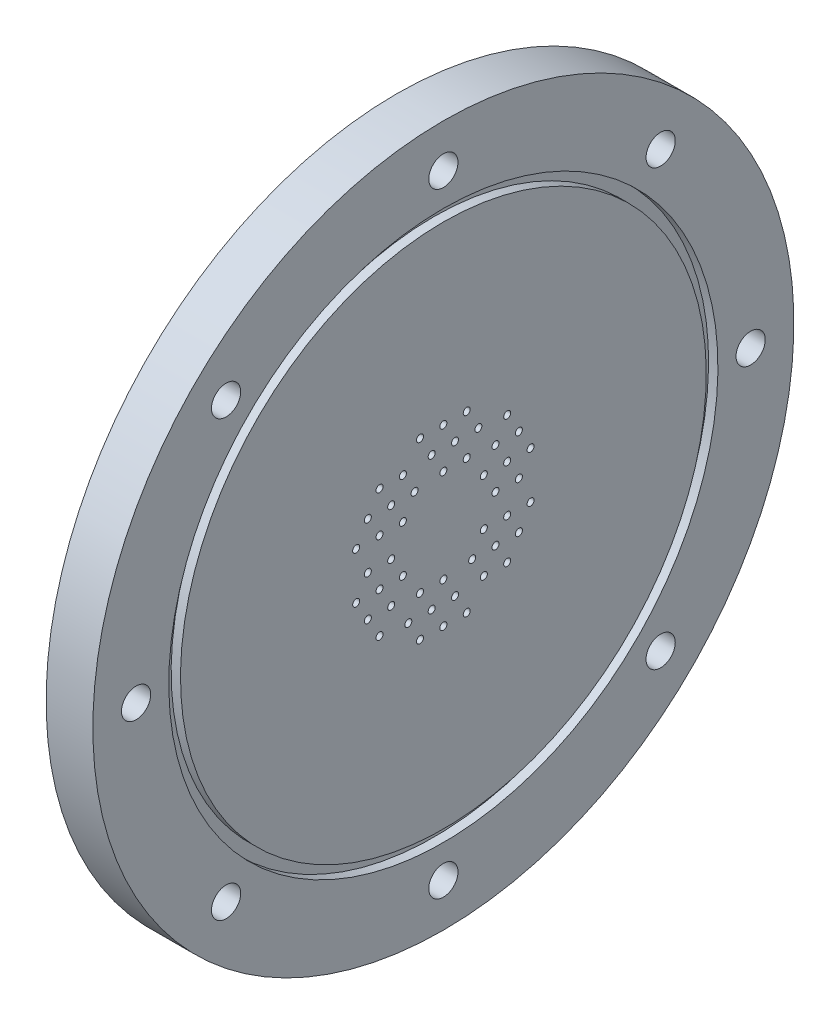
from build123d import *

# Parameters (mm, degrees)
SKETCH2_R                    = 0.762
CUT_EXTRUDE1_DEPTH           = 109.240960824
CHAMFER1_SIZE                = 0.508
CIRPATTERN1_COUNT            = 6
CHAMFER1_OF_CIRPATTERN1_SIZE = 0.508
SKETCH3_R                    = 3.175
CUT_EXTRUDE2_DEPTH           = 109.240960824
CIRPATTERN2_COUNT            = 8
SKETCH4_W                    = 2.032
SKETCH4_H                    = 2.54
SKETCH4_W_2                  = 1.27


with BuildPart() as part:
    # Sketch1 → Revolve1 (revolve)
    with BuildSketch(Plane.XY):
        with BuildLine():
            Line((0, 0), (0, 48.26))
            ThreePointArc((0, 48.26), (-0.743948776, 50.056051224), (-2.54, 50.8))
            Line((-2.54, 50.8), (-6.35, 50.8))
            Line((-6.35, 50.8), (-6.35, 76.2))
            Line((-6.35, 76.2), (3.81, 76.2))
            Line((3.81, 76.2), (3.81, 0))
            Line((3.81, 0), (0, 0))
        make_face()
    revolve(axis=Axis((-6.35, 0, 0), (1, 0, 0)))

    # Sketch2 → Cut-Extrude1 (cut, through all)
    with BuildSketch(Plane(origin=(3.81, 0, 0), x_dir=(0, 0, -1), z_dir=(1, 0, 0))):
        with Locations((0, 10.16)):
            Circle(SKETCH2_R)
        with Locations((-2.54, 14.559409051)):
            Circle(SKETCH2_R)
        with Locations((5.08, 10.16)):
            Circle(SKETCH2_R)
        with Locations((-5.08, 18.958818102)):
            Circle(SKETCH2_R)
        with Locations((0, 18.958818102)):
            Circle(SKETCH2_R)
        with Locations((5.08, 18.958818102)):
            Circle(SKETCH2_R)
        with Locations((7.62, 14.559409051)):
            Circle(SKETCH2_R)
        with Locations((2.54, 14.559409051)):
            Circle(SKETCH2_R)
    cut_extrude1 = extrude(amount=-CUT_EXTRUDE1_DEPTH, mode=Mode.SUBTRACT)

    # Chamfer1
    chamfer1_edges = [part.edges().sort_by_distance(p)[0] for p in [
        (0, 10.16, 0.762),
        (0, 10.16, -4.318),
        (0, 14.559409051, -6.858),
        (0, 14.559409051, -1.778),
        (0, 14.559409051, 3.302),
        (0, 18.958818102, 5.842),
        (0, 18.958818102, 0.762),
        (0, 18.958818102, -4.318),
    ]]
    chamfer(chamfer1_edges, length=CHAMFER1_SIZE)

    # CirPattern1: Cut-Extrude1 ×6 about axis
    cirpattern1_axis = Axis((-6.35, 0, 0), (-1, 0, 0))
    for i in range(1, CIRPATTERN1_COUNT):
        add(cut_extrude1.rotate(cirpattern1_axis, i * 360 / CIRPATTERN1_COUNT), mode=Mode.SUBTRACT)

    # Chamfer1 of CirPattern1
    chamfer1_of_cirpattern1_edges = [part.edges().sort_by_distance(p)[0] for p in [
        (0, 5.739911358, -8.417818102),
        (0, 1.340502306, -10.957818102),
        (0, 1.340502306, -16.037818102),
        (0, 5.739911358, -13.497818102),
        (0, 10.139320409, -10.957818102),
        (0, 14.53872946, -13.497818102),
        (0, 10.139320409, -16.037818102),
        (0, 5.739911358, -18.577818102),
        (0, -4.420088642, -9.179818102),
        (0, -8.819497694, -6.639818102),
        (0, -13.218906745, -9.179818102),
        (0, -8.819497694, -11.719818102),
        (0, -4.420088642, -14.259818102),
        (0, -4.420088642, -19.339818102),
        (0, -8.819497694, -16.799818102),
        (0, -13.218906745, -14.259818102),
        (0, -10.16, -0.762),
        (0, -10.16, 4.318),
        (0, -14.559409051, 6.858),
        (0, -14.559409051, 1.778),
        (0, -14.559409051, -3.302),
        (0, -18.958818102, -5.842),
        (0, -18.958818102, -0.762),
        (0, -18.958818102, 4.318),
        (0, -5.739911358, 8.417818102),
        (0, -1.340502306, 10.957818102),
        (0, -1.340502306, 16.037818102),
        (0, -5.739911358, 13.497818102),
        (0, -10.139320409, 10.957818102),
        (0, -14.53872946, 13.497818102),
        (0, -10.139320409, 16.037818102),
        (0, -5.739911358, 18.577818102),
        (0, 4.420088642, 9.179818102),
        (0, 8.819497694, 6.639818102),
        (0, 13.218906745, 9.179818102),
        (0, 8.819497694, 11.719818102),
        (0, 4.420088642, 14.259818102),
        (0, 4.420088642, 19.339818102),
        (0, 8.819497694, 16.799818102),
        (0, 13.218906745, 14.259818102),
    ]]
    chamfer(chamfer1_of_cirpattern1_edges, length=CHAMFER1_OF_CIRPATTERN1_SIZE)

    # Sketch3 → Cut-Extrude2 (cut, through all)
    with BuildSketch(Plane(origin=(3.81, 0, 0), x_dir=(0, 0, -1), z_dir=(1, 0, 0))):
        with Locations((-66.802, 0)):
            Circle(SKETCH3_R)
    cut_extrude2 = extrude(amount=-CUT_EXTRUDE2_DEPTH, mode=Mode.SUBTRACT)

    # CirPattern2: Cut-Extrude2 ×8 about axis
    cirpattern2_axis = Axis((-6.35, 0, 0), (-1, 0, 0))
    for i in range(1, CIRPATTERN2_COUNT):
        add(cut_extrude2.rotate(cirpattern2_axis, i * 360 / CIRPATTERN2_COUNT), mode=Mode.SUBTRACT)

    # Sketch4 → Cut-Revolve1 (revolve, cut)
    with BuildSketch(Plane.XY):
        with Locations((2.794, 58.42)):
            Rectangle(SKETCH4_W, SKETCH4_H)
        with Locations((-5.334, 58.42)):
            Rectangle(SKETCH4_W, SKETCH4_H)
        with Locations((-5.715, 52.07)):
            Rectangle(SKETCH4_W_2, SKETCH4_H)
    revolve(axis=Axis((0, 0, 0), (-1, 0, 0)), mode=Mode.SUBTRACT)


solid = part.part
